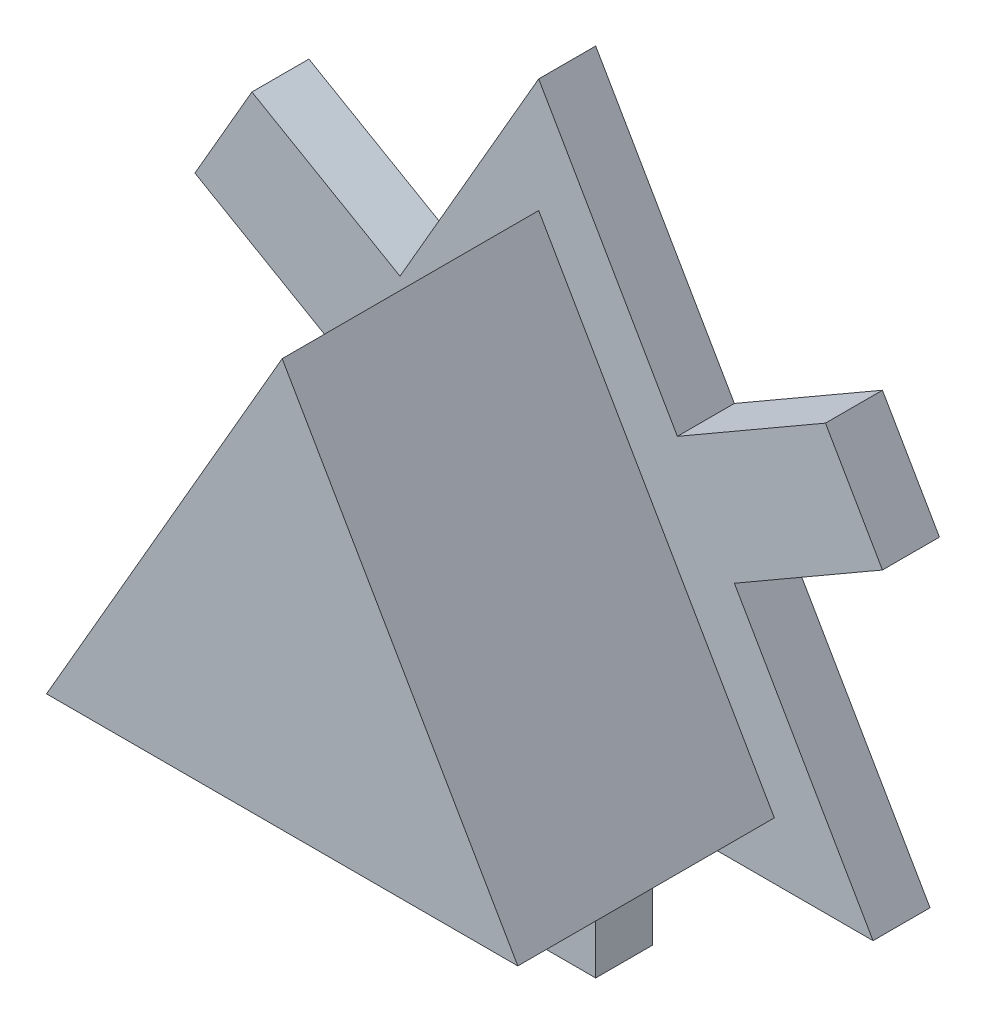
from build123d import *

# Parameters (mm, degrees)
BOSS_EXTRUDE1_DEPTH = 4.5
BOSS_EXTRUDE2_DEPTH = 1


with BuildPart() as part:
    # Sketch1 → Boss-Extrude1 (new body)
    with BuildSketch(Plane.XY):
        Polygon((4.379239374, -1.298375708), (12.647188566, -1.298375708), (8.51321397, 5.86187833), align=None)
    extrude(amount=BOSS_EXTRUDE1_DEPTH)

    # Sketch2 → Boss-Extrude2 (add)
    with BuildSketch(Plane(origin=(0, 0, 0), x_dir=(-1, 0, 0), z_dir=(0, 0, -1))):
        Polygon((-14.544302883, 3.415725908), (-11.946226672, 1.915725908), (-14.379239374, -2.298375708), (-9.51321397, -2.298375708), (-9.51321397, -5.298375708), (-7.51321397, -5.298375708), (-7.51321397, -2.298375708), (-2.647188566, -2.298375708), (-5.080201268, 1.915725908), (-2.482125057, 3.415725908), (-3.482125057, 5.147776715), (-6.080201268, 3.647776715), (-8.51321397, 7.86187833), (-10.946226672, 3.647776715), (-13.544302883, 5.147776715), align=None)
    extrude(amount=BOSS_EXTRUDE2_DEPTH)


solid = part.part
